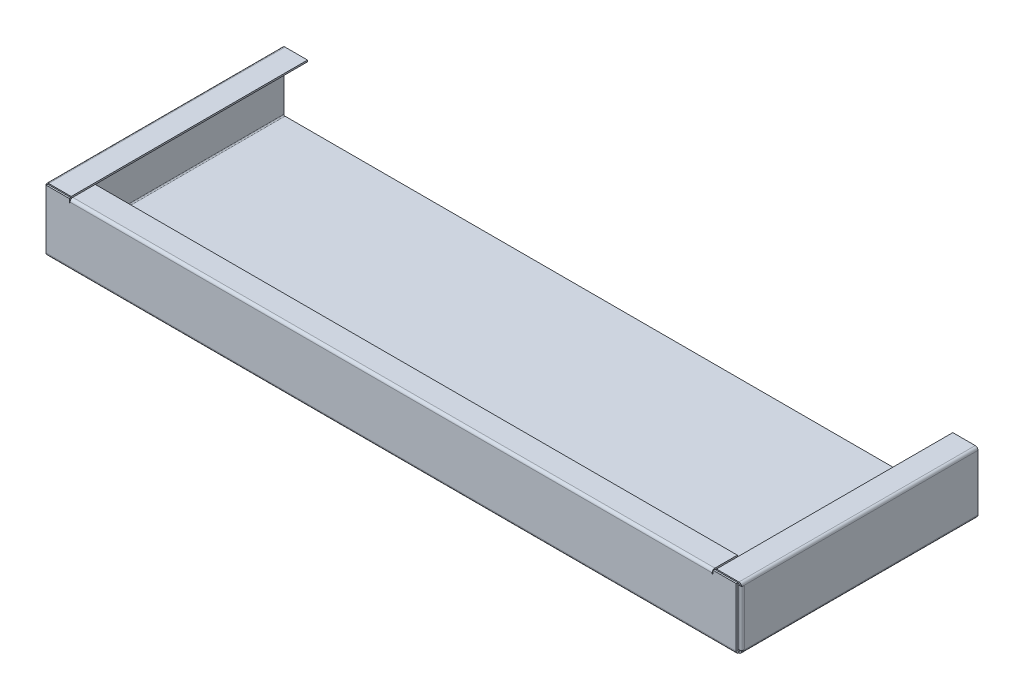
from build123d import *

# Parameters (mm, degrees)
SKETCH71_W                              = 220.8
SKETCH71_H                              = 150
BASE_FLANGE_DEPTH                       = 1
EDGE_FLANGE_SIDE_STRIP_W                = 5.4732
EDGE_FLANGE_SIDE_STRIP_H                = 1
EDGE_FLANGE_SIDE_STRIP_CUT_DEPTH        = 150
EDGE_FLANGE_SIDE_DEPTH                  = 150
EDGE_FLANGE_SIDE_TOP_STRIP_W            = 5.4732
EDGE_FLANGE_SIDE_TOP_STRIP_H            = 1
EDGE_FLANGE_SIDE_TOP_STRIP_CUT_DEPTH    = 150
EDGE_FLANGE_SIDE_TOP_DEPTH              = 150
EDGE_FLANGE_BOTTOM_DEPTH                = 219.0634
EDGE_FLANGE_BOTTOM_TOP_STRIP_W          = 5.4732
EDGE_FLANGE_BOTTOM_TOP_STRIP_H          = 1
EDGE_FLANGE_BOTTOM_TOP_STRIP_CUT_DEPTH  = 203.8
EDGE_FLANGE_BOTTOM_TOP_RELIEF_W         = 5.9732
EDGE_FLANGE_BOTTOM_TOP_RELIEF_H         = 0.5
EDGE_FLANGE_BOTTOM_TOP_RELIEF_CUT_DEPTH = 1
EDGE_FLANGE_BOTTOM_TOP_DEPTH            = 203.8
EDGE_FLANGE_SIDE_BOTTOM_STRIP_W         = 5.4732
EDGE_FLANGE_SIDE_BOTTOM_STRIP_H         = 1
EDGE_FLANGE_SIDE_BOTTOM_STRIP_CUT_DEPTH = 35.5268
EDGE_FLANGE_SIDE_BOTTOM_DEPTH           = 35.5268


# Sheet-metal steps are written as plain solids
with BuildPart() as part:
    # Sketch71 → Base-Flange (new body)
    with BuildSketch(Plane(origin=(0, -19.5, 0), x_dir=(1, 0, 0), z_dir=(0, 1, 0))):
        with Locations((110.4, -75.7366)):
            Rectangle(SKETCH71_W, SKETCH71_H)
    extrude(amount=BASE_FLANGE_DEPTH)

    # Edge-Flange-Side strip (across the edge) → Edge-Flange-Side strip cut (cut)
    with BuildSketch(Plane(origin=(220.8, -18.5, 150.7366), x_dir=(-1, 0, 0), z_dir=(0, 0, -1))):
        with Locations((-1, -0.5)):
            Rectangle(EDGE_FLANGE_SIDE_STRIP_W, EDGE_FLANGE_SIDE_STRIP_H)
    extrude(amount=EDGE_FLANGE_SIDE_STRIP_CUT_DEPTH, mode=Mode.SUBTRACT)

    # Edge-Flange-Side section (across the edge) → Edge-Flange-Side (add)
    with BuildSketch(Plane(origin=(220.8, -18.5, 150.7366), x_dir=(-1, 0, 0), z_dir=(0, 0, -1))):
        with BuildLine():
            Line((0, 0.7366), (0, 38))
            Line((0, 38), (1, 38))
            Line((1, 38), (1, 0.7366))
            ThreePointArc((1, 0.7366), (1.215745145, 0.215745145), (1.7366, 0))
            Line((1.7366, 0), (1.7366, -1))
            ThreePointArc((1.7366, -1), (0.508638364, -0.491361636), (0, 0.7366))
        make_face()
    extrude(amount=EDGE_FLANGE_SIDE_DEPTH)

    # Edge-Flange-Side-Top strip (across the edge) → Edge-Flange-Side-Top strip cut (cut)
    with BuildSketch(Plane(origin=(219.8, 19.5, 150.7366), x_dir=(0, -1, 0), z_dir=(0, 0, -1))):
        with Locations((-1, -0.5)):
            Rectangle(EDGE_FLANGE_SIDE_TOP_STRIP_W, EDGE_FLANGE_SIDE_TOP_STRIP_H)
    extrude(amount=EDGE_FLANGE_SIDE_TOP_STRIP_CUT_DEPTH, mode=Mode.SUBTRACT)

    # Edge-Flange-Side-Top section (across the edge) → Edge-Flange-Side-Top (add)
    with BuildSketch(Plane(origin=(219.8, 19.5, 150.7366), x_dir=(0, -1, 0), z_dir=(0, 0, -1))):
        with BuildLine():
            Line((0, 0.7366), (0, 15))
            Line((0, 15), (1, 15))
            Line((1, 15), (1, 0.7366))
            ThreePointArc((1, 0.7366), (1.215745145, 0.215745145), (1.7366, 0))
            Line((1.7366, 0), (1.7366, -1))
            ThreePointArc((1.7366, -1), (0.508638364, -0.491361636), (0, 0.7366))
        make_face()
    extrude(amount=EDGE_FLANGE_SIDE_TOP_DEPTH)

    # Edge-Flange-Bottom section (across the edge) → Edge-Flange-Bottom (add)
    with BuildSketch(Plane(origin=(0, -18.5, 151.4732), x_dir=(0, 0, -1), z_dir=(1, 0, 0))):
        with BuildLine():
            Line((-1, 0.7366), (-1, 38))
            Line((-1, 38), (0, 38))
            Line((0, 38), (0, 0.7366))
            ThreePointArc((0, 0.7366), (0.215745145, 0.215745145), (0.7366, 0))
            Line((0.7366, 0), (0.7366, -1))
            ThreePointArc((0.7366, -1), (-0.491361636, -0.491361636), (-1, 0.7366))
        make_face()
    extrude(amount=EDGE_FLANGE_BOTTOM_DEPTH)

    # Edge-Flange-Bottom-Top strip (across the edge) → Edge-Flange-Bottom-Top strip cut (cut)
    with BuildSketch(Plane(origin=(0, 19.5, 151.4732), x_dir=(0, -1, 0), z_dir=(1, 0, 0))):
        with Locations((-1, -0.5)):
            Rectangle(EDGE_FLANGE_BOTTOM_TOP_STRIP_W, EDGE_FLANGE_BOTTOM_TOP_STRIP_H)
    extrude(amount=EDGE_FLANGE_BOTTOM_TOP_STRIP_CUT_DEPTH, mode=Mode.SUBTRACT)

    # Edge-Flange-Bottom-Top relief (on the sheet) → Edge-Flange-Bottom-Top relief cut (cut)
    with BuildSketch(Plane(origin=(0, 17.7634, 151.4732), x_dir=(0, -1, 0), z_dir=(0, 0, -1))):
        with Locations((-2.4866, -204.05)):
            Rectangle(EDGE_FLANGE_BOTTOM_TOP_RELIEF_W, EDGE_FLANGE_BOTTOM_TOP_RELIEF_H)
    extrude(amount=-EDGE_FLANGE_BOTTOM_TOP_RELIEF_CUT_DEPTH, mode=Mode.SUBTRACT)

    # Edge-Flange-Bottom-Top section (across the edge) → Edge-Flange-Bottom-Top (add)
    with BuildSketch(Plane(origin=(0, 19.5, 151.4732), x_dir=(0, -1, 0), z_dir=(1, 0, 0))):
        with BuildLine():
            Line((0, 0.7366), (0, 15))
            Line((0, 15), (1, 15))
            Line((1, 15), (1, 0.7366))
            ThreePointArc((1, 0.7366), (1.215745145, 0.215745145), (1.7366, 0))
            Line((1.7366, 0), (1.7366, -1))
            ThreePointArc((1.7366, -1), (0.508638364, -0.491361636), (0, 0.7366))
        make_face()
    extrude(amount=EDGE_FLANGE_BOTTOM_TOP_DEPTH)

    # Edge-Flange-Side-Bottom strip (across the edge) → Edge-Flange-Side-Bottom strip cut (cut)
    with BuildSketch(Plane(origin=(219.8, -17.7634, 150.7366), x_dir=(0, 0, -1), z_dir=(0, 1, 0))):
        with Locations((-1, -0.5)):
            Rectangle(EDGE_FLANGE_SIDE_BOTTOM_STRIP_W, EDGE_FLANGE_SIDE_BOTTOM_STRIP_H)
    extrude(amount=EDGE_FLANGE_SIDE_BOTTOM_STRIP_CUT_DEPTH, mode=Mode.SUBTRACT)

    # Edge-Flange-Side-Bottom section (across the edge) → Edge-Flange-Side-Bottom (add)
    with BuildSketch(Plane(origin=(219.8, -17.7634, 150.7366), x_dir=(0, 0, -1), z_dir=(0, 1, 0))):
        with BuildLine():
            Line((0, 0.7366), (0, 7.5))
            Line((0, 7.5), (1, 7.5))
            Line((1, 7.5), (1, 0.7366))
            ThreePointArc((1, 0.7366), (1.215745145, 0.215745145), (1.7366, 0))
            Line((1.7366, 0), (1.7366, -1))
            ThreePointArc((1.7366, -1), (0.508638364, -0.491361636), (0, 0.7366))
        make_face()
    extrude(amount=EDGE_FLANGE_SIDE_BOTTOM_DEPTH)

    # Mirror-Vertical: part across plane


with BuildPart() as part_1:
    add(part.part)
    add(part.part.mirror(Plane(origin=(0, -18.5, 0.7366), x_dir=(0, 0, 1), z_dir=(1, 0, 0))))


solid = part_1.part
